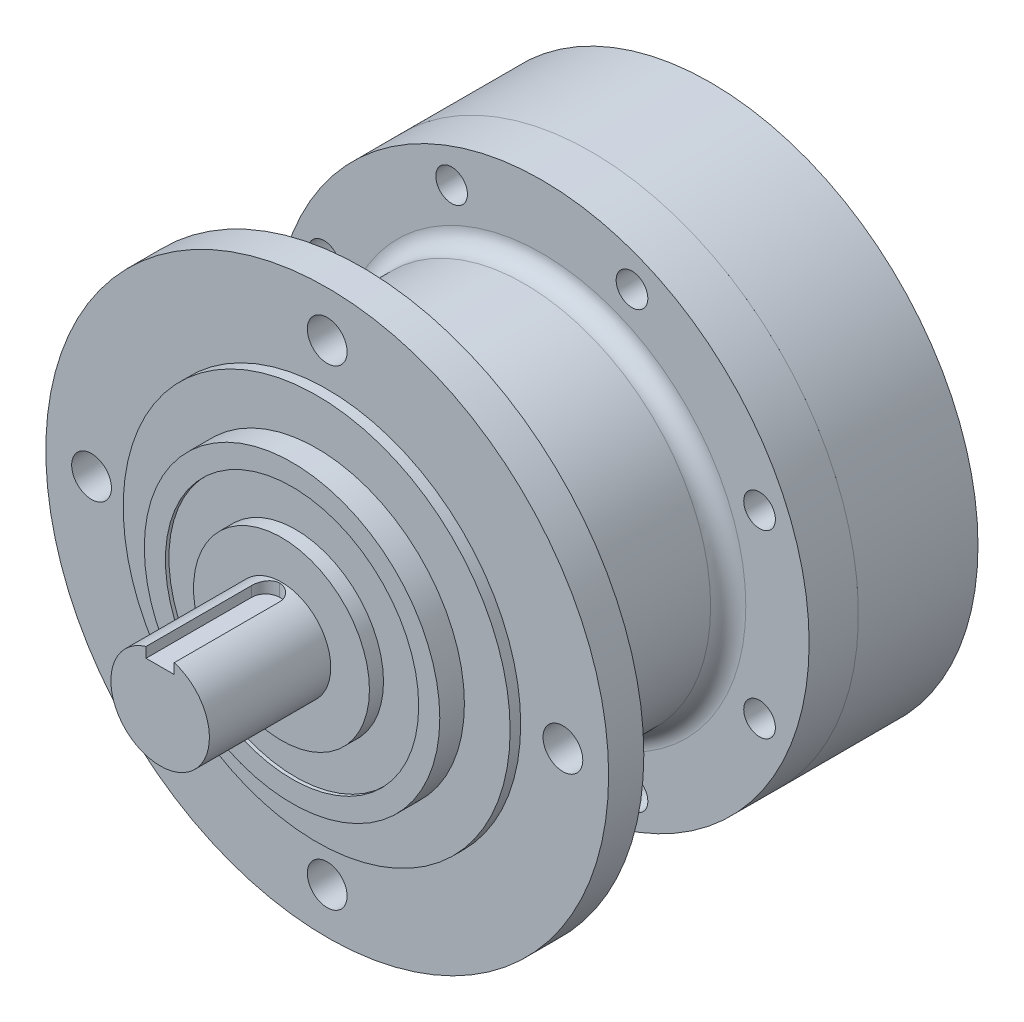
from build123d import *

# Parameters (mm, degrees)
SKETCH_1_R          = 76
EXTRUDE_1_DEPTH     = 48
SKETCH_2_R          = 53
EXTRUDE_2_DEPTH     = 51
SKETCH_3_R          = 80
EXTRUDE_3_DEPTH     = 10
FILLET_1_R          = 5
SKETCH_4_R          = 55
EXTRUDE_4_DEPTH     = 3
SKETCH_5_R          = 42
EXTRUDE_5_DEPTH     = 7
SKETCH_6_R          = 25
EXTRUDE_6_DEPTH     = 3
CUT_EXTRUDE_START   = -1
SKETCH_7_R          = 36
SKETCH_7_R_2        = 25
CUT_EXTRUDE_1_DEPTH = 1
SKETCH_8_R          = 14
EXTRUDE_7_DEPTH     = 34.5
SKETCH_9_W          = 8
SKETCH_9_H          = 3.5
CUT_EXTRUDE_3_DEPTH = 34
FILLET_2_R          = 4
SKETCH_10_R         = 5.65
CUT_EXTRUDE_4_DEPTH = 14
SKETCH_11_R         = 4.5
CUT_EXTRUDE_5_DEPTH = 74
SKETCH_12_R         = 76
CUT_EXTRUDE_6_DEPTH = 0.001
SKETCH_13_R         = 53.5
SKETCH_13_R_2       = 52.5
CUT_EXTRUDE_7_DEPTH = 34
SKETCH_14_R         = 7.5
CUT_EXTRUDE_8_DEPTH = 27
CUT_EXTRUDE_9_DEPTH = 27


with BuildPart() as part:
    # 草图1 → 拉伸1 (new body)
    with BuildSketch(Plane.XY):
        Circle(SKETCH_1_R)
    extrude(amount=EXTRUDE_1_DEPTH)

    # 草图2 → 拉伸2 (add)
    with BuildSketch(Plane.XY.offset(48)):
        Circle(SKETCH_2_R)
    extrude(amount=EXTRUDE_2_DEPTH)

    # 草图3 → 拉伸3 (add)
    with BuildSketch(Plane.XY.offset(99)):
        Circle(SKETCH_3_R)
    extrude(amount=EXTRUDE_3_DEPTH)

    # 圆角1
    fillet_1_edges = [part.edges().sort_by_distance(p)[0] for p in [
        (-53, 0, 48),
        (-53, 0, 99),
    ]]
    fillet(fillet_1_edges, radius=FILLET_1_R)

    # 草图4 → 拉伸4 (add)
    with BuildSketch(Plane.XY.offset(109)):
        Circle(SKETCH_4_R)
    extrude(amount=EXTRUDE_4_DEPTH)

    # 草图5 → 拉伸5 (add)
    with BuildSketch(Plane.XY.offset(112)):
        Circle(SKETCH_5_R)
    extrude(amount=EXTRUDE_5_DEPTH)

    # 草图6 → 拉伸6 (add)
    with BuildSketch(Plane.XY.offset(119)):
        Circle(SKETCH_6_R)
    extrude(amount=EXTRUDE_6_DEPTH)

    # 草图7 → 切除-拉伸1 (cut)
    with BuildSketch(Plane.XY.offset(119).offset(CUT_EXTRUDE_START)):
        Circle(SKETCH_7_R)
        Circle(SKETCH_7_R_2, mode=Mode.SUBTRACT)
    extrude(amount=CUT_EXTRUDE_1_DEPTH, mode=Mode.SUBTRACT)

    # 草图8 → 拉伸7 (add)
    with BuildSketch(Plane.XY.offset(122)):
        Circle(SKETCH_8_R)
    extrude(amount=EXTRUDE_7_DEPTH)

    # 草图9 → 切除-拉伸3 (cut)
    with BuildSketch(Plane.XY.offset(156.5)):
        with Locations((0, 12.25)):
            Rectangle(SKETCH_9_W, SKETCH_9_H)
    extrude(amount=-CUT_EXTRUDE_3_DEPTH, mode=Mode.SUBTRACT)

    # 圆角2
    fillet_2_edges = [part.edges().sort_by_distance(p)[0] for p in [
        (-4, 11.958203932, 122.5),
        (4, 11.958203932, 122.5),
    ]]
    fillet(fillet_2_edges, radius=FILLET_2_R - 0.0001)  # a hair under: the kernel refuses the full size

    # 草图10 → 切除-拉伸4 (cut)
    with BuildSketch(Plane.XY.offset(109)):
        with Locations((0, 67)):
            Circle(SKETCH_10_R)
        with Locations((67, 0)):
            Circle(SKETCH_10_R)
        with Locations((0, -67)):
            Circle(SKETCH_10_R)
        with Locations((-67, 0)):
            Circle(SKETCH_10_R)
    extrude(amount=-CUT_EXTRUDE_4_DEPTH, mode=Mode.SUBTRACT)

    # 草图11 → 切除-拉伸5 (cut)
    with BuildSketch(Plane(origin=(0, 0, 0), x_dir=(-1, 0, 0), z_dir=(0, 0, -1))):
        with Locations((61.899928678, 25.639789968)):
            Circle(SKETCH_11_R)
        with Locations((61.899928678, -25.639789968)):
            Circle(SKETCH_11_R)
        with Locations((25.639789968, -61.899928678)):
            Circle(SKETCH_11_R)
        with Locations((-25.639789968, -61.899928678)):
            Circle(SKETCH_11_R)
        with Locations((-61.899928678, -25.639789968)):
            Circle(SKETCH_11_R)
        with Locations((-61.899928678, 25.639789968)):
            Circle(SKETCH_11_R)
        with Locations((-25.639789968, 61.899928678)):
            Circle(SKETCH_11_R)
        with Locations((25.639789968, 61.899928678)):
            Circle(SKETCH_11_R)
    extrude(amount=-CUT_EXTRUDE_5_DEPTH, mode=Mode.SUBTRACT)

    # 草图12 → 切除-拉伸6 (cut)
    with BuildSketch(Plane(origin=(0, 0, 34), x_dir=(-1, 0, 0), z_dir=(0, 0, -1))):
        Circle(SKETCH_12_R)
    extrude(amount=-CUT_EXTRUDE_6_DEPTH, mode=Mode.SUBTRACT)


with BuildPart() as cut_extrude_6_piece_1:
    # of the separate pieces the step leaves, piece 1, a body of its own (cut_extrude_6_pieces)
    add(part.part.solids().sort_by_distance((4, 13.416407865, 126.4999))[0])


with BuildPart() as cut_extrude_6_piece_2:
    # of the separate pieces the step leaves, piece 2, a body of its own (cut_extrude_6_pieces)
    add(part.part.solids().sort_by_distance((76, 0, 0))[0])

    # 草图13 → 切除-拉伸7 (cut)
    with BuildSketch(Plane(origin=(0, 0, 0), x_dir=(-1, 0, 0), z_dir=(0, 0, -1))):
        Circle(SKETCH_13_R)
        Circle(SKETCH_13_R_2, mode=Mode.SUBTRACT)
    extrude(amount=-CUT_EXTRUDE_7_DEPTH, mode=Mode.SUBTRACT)


with BuildPart() as cut_extrude_7_piece_1:
    # of the separate pieces the step leaves, piece 1, a body of its own (cut_extrude_7_pieces)
    add(cut_extrude_6_piece_2.part.solids().sort_by_distance((-52.5, 0, 0))[0])

    # 草图14 → 切除-拉伸8 (cut)
    with BuildSketch(Plane(origin=(0, 0, 0), x_dir=(-1, 0, 0), z_dir=(0, 0, -1))):
        Circle(SKETCH_14_R)
    extrude(amount=-CUT_EXTRUDE_8_DEPTH, mode=Mode.SUBTRACT)

    # 草图15 → 切除-拉伸9 (cut)
    with BuildSketch(Plane(origin=(0, 0, 0), x_dir=(-1, 0, 0), z_dir=(0, 0, -1))):
        with BuildLine():
            Line((-2.5, 10), (2.5, 10))
            Line((2.5, 10), (2.5, 7.071067812))
            ThreePointArc((2.5, 7.071067812), (0, 7.5), (-2.5, 7.071067812))
            Line((-2.5, 7.071067812), (-2.5, 10))
        make_face()
    extrude(amount=-CUT_EXTRUDE_9_DEPTH, mode=Mode.SUBTRACT)


with BuildPart() as cut_extrude_7_piece_2:
    # of the separate pieces the step leaves, piece 2, a body of its own (cut_extrude_7_pieces)
    add(cut_extrude_6_piece_2.part.solids().sort_by_distance((76, 0, 0))[0])


solid = Compound([cut_extrude_6_piece_1.part, cut_extrude_7_piece_1.part, cut_extrude_7_piece_2.part])
